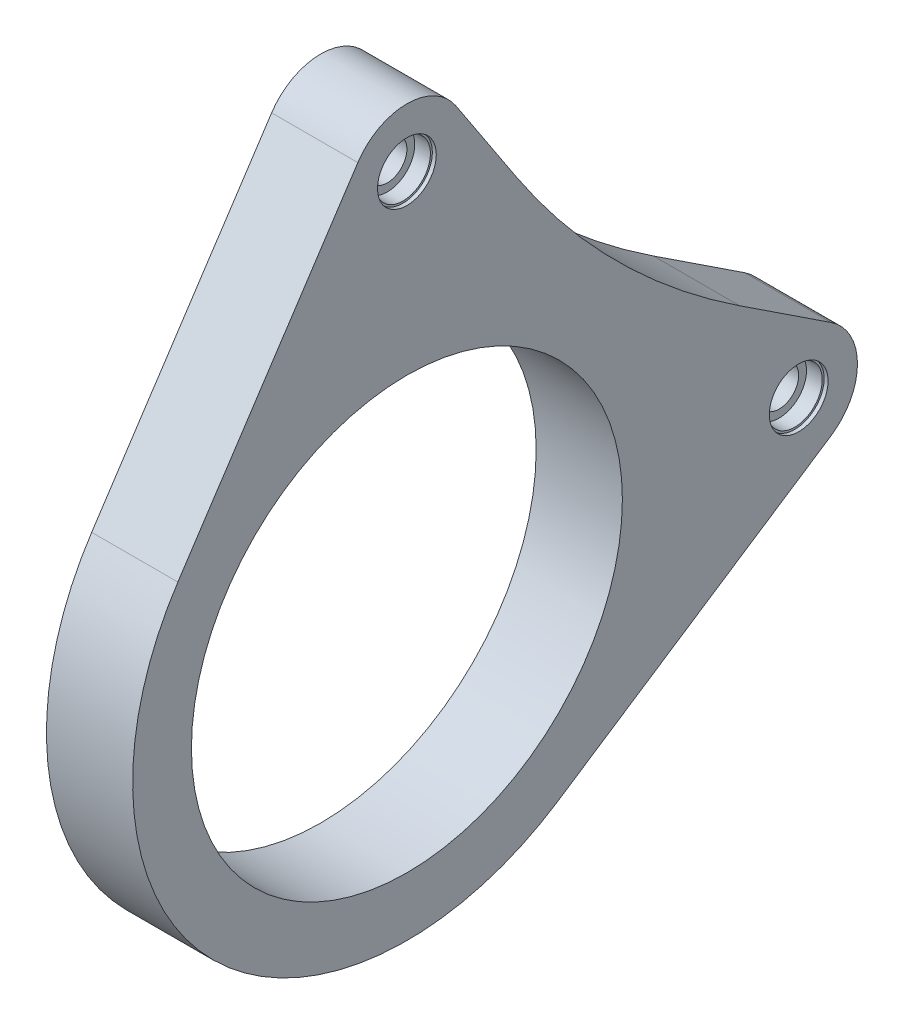
from build123d import *

# Parameters (mm, degrees)
SKETCH1_R                                  = 55
SKETCH1_R_2                                = 5
BOSS_EXTRUDE1_DEPTH                        = 11
SKETCH2_R                                  = 7.5
CUT_EXTRUDE1_DEPTH                         = 1
SKETCH3_R                                  = 7
CUT_EXTRUDE2_DEPTH                         = 4
MIRROR1_AT_THE_SECOND_PLANE_COPY_1_SKETC_R = 7.5
MIRROR1_AT_THE_SECOND_PLANE_COPY_1_DEPTH   = 1
MIRROR1_AT_THE_SECOND_PLANE_COPY_2_SKETC_R = 7
MIRROR1_AT_THE_SECOND_PLANE_COPY_2_DEPTH   = 4
FILLET1_R                                  = 200


with BuildPart() as part:
    # Sketch1 → Boss-Extrude1 (new, symmetric)
    with BuildSketch(Plane(origin=(0, 0, 0), x_dir=(0, 0, -1), z_dir=(1, 0, 0))):
        with BuildLine():
            Line((-58.46152581, 38.5), (-12.527469816, 108.25))
            ThreePointArc((-12.527469816, 108.25), (0, 115), (12.527469816, 108.25))
            Line((12.527469816, 108.25), (50.535508379, 50.535508379))
            Line((50.535508379, 50.535508379), (108.25, 12.527469816))
            ThreePointArc((108.25, 12.527469816), (115, 0), (108.25, -12.527469816))
            Line((108.25, -12.527469816), (38.5, -58.46152581))
            ThreePointArc((38.5, -58.46152581), (-49.497474683, -49.497474683), (-58.46152581, 38.5))
        make_face()
        Circle(SKETCH1_R, mode=Mode.SUBTRACT)
        with Locations((0, 100)):
            Circle(SKETCH1_R_2, mode=Mode.SUBTRACT)
        with Locations((100, 0)):
            Circle(SKETCH1_R_2, mode=Mode.SUBTRACT)
    extrude(amount=BOSS_EXTRUDE1_DEPTH, both=True)

    # Sketch2 → Cut-Extrude1 (cut)
    with BuildSketch(Plane(origin=(11, 0, 0), x_dir=(0, 0, -1), z_dir=(1, 0, 0))):
        with Locations((0, 100)):
            Circle(SKETCH2_R)
    cut_extrude1 = extrude(amount=-CUT_EXTRUDE1_DEPTH, mode=Mode.SUBTRACT)

    # Sketch3 → Cut-Extrude2 (cut)
    with BuildSketch(Plane(origin=(10, 0, 0), x_dir=(0, 0, -1), z_dir=(1, 0, 0))):
        with Locations((0, 100)):
            Circle(SKETCH3_R)
    cut_extrude2 = extrude(amount=-CUT_EXTRUDE2_DEPTH, mode=Mode.SUBTRACT)

    # Mirror1: Cut-Extrude1, Cut-Extrude2 across plane
    add(cut_extrude1.mirror(Plane(origin=(0, 0, 0), x_dir=(0, -0.7071067811865464, 0.7071067811865487), z_dir=(0, -0.7071067811865487, -0.7071067811865464))), mode=Mode.SUBTRACT)
    add(cut_extrude2.mirror(Plane(origin=(0, 0, 0), x_dir=(0, -0.7071067811865464, 0.7071067811865487), z_dir=(0, -0.7071067811865487, -0.7071067811865464))), mode=Mode.SUBTRACT)

    # Mirror1 at the second plane: Cut-Extrude1, Cut-Extrude2 across plane
    add(cut_extrude1.mirror(Plane(origin=(0, 0, 0), x_dir=(0, 0, 1), z_dir=(1, 0, 0))), mode=Mode.SUBTRACT)
    add(cut_extrude2.mirror(Plane(origin=(0, 0, 0), x_dir=(0, 0, 1), z_dir=(1, 0, 0))), mode=Mode.SUBTRACT)

    # Mirror1 at the second plane copy 1 sketc → Mirror1 at the second plane copy 1 (cut)
    with BuildSketch(Plane(origin=(-11, 0, 0), x_dir=(0, 1, 0), z_dir=(-1, 0, 0))):
        with Locations((0, 100)):
            Circle(MIRROR1_AT_THE_SECOND_PLANE_COPY_1_SKETC_R)
    extrude(amount=-MIRROR1_AT_THE_SECOND_PLANE_COPY_1_DEPTH, mode=Mode.SUBTRACT)

    # Mirror1 at the second plane copy 2 sketc → Mirror1 at the second plane copy 2 (cut)
    with BuildSketch(Plane(origin=(-10, 0, 0), x_dir=(0, 1, 0), z_dir=(-1, 0, 0))):
        with Locations((0, 100)):
            Circle(MIRROR1_AT_THE_SECOND_PLANE_COPY_2_SKETC_R)
    extrude(amount=-MIRROR1_AT_THE_SECOND_PLANE_COPY_2_DEPTH, mode=Mode.SUBTRACT)

    # Fillet1
    fillet1_edges = [part.edges().sort_by_distance(p)[0] for p in [
        (0, 50.535508379, -50.535508379),
    ]]
    fillet(fillet1_edges, radius=FILLET1_R)


solid = part.part
